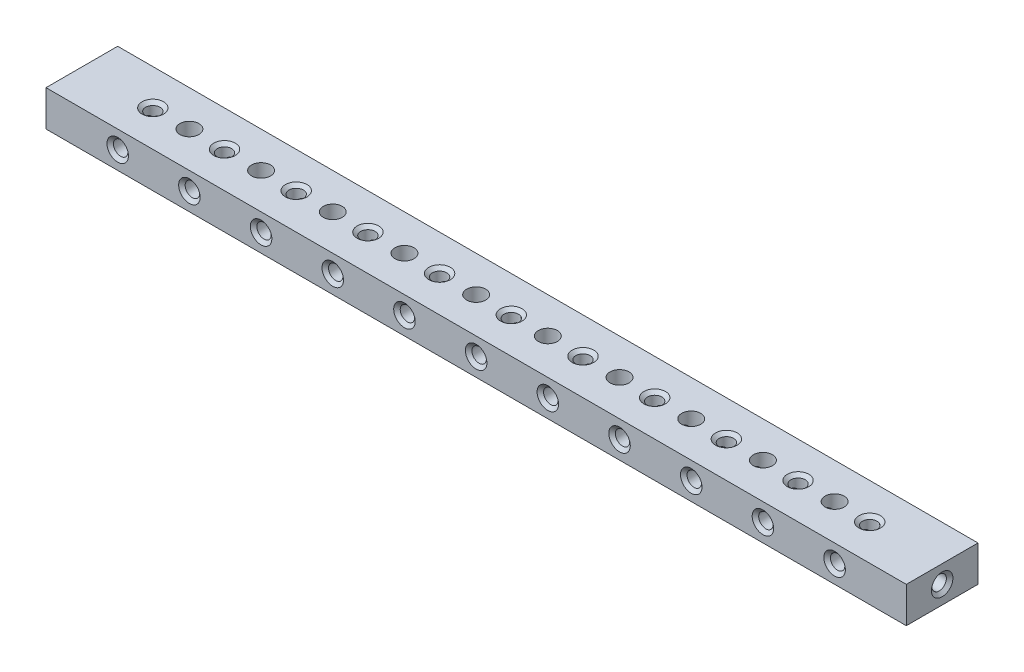
from build123d import *

# Parameters (mm, degrees)
SKETCH1_W                                            = 304.8
SKETCH1_H                                            = 25.4
BOSS_EXTRUDE1_DEPTH                                  = 12.7
F_1_4_20_TAPPED_HOLE1_D                              = 5.1054
F_1_4_20_TAPPED_HOLE1_CSINK_D                        = 7.62
F_1_4_20_TAPPED_HOLE1_CSINK_ANGLE                    = 100
LPATTERN1_COUNT                                      = 8
LPATTERN1_PITCH                                      = 25.4
F_1_4_20_TAPPED_HOLE2_D                              = 5.1054
F_1_4_20_TAPPED_HOLE2_CSINK_D                        = 7.62
F_1_4_20_TAPPED_HOLE2_CSINK_ANGLE                    = 100
LPATTERN2_COUNT                                      = 8
LPATTERN2_PITCH                                      = 25.4
CBORE_FOR_1_4_BINDING_HEAD_MACHINE_SCREW_D           = 6.7564
CBORE_FOR_1_4_BINDING_HEAD_MACHINE_SCREW_DEPTH       = 88.9
CBORE_FOR_1_4_BINDING_HEAD_MACHINE_SCREW_CBORE_D     = 14.2875
CBORE_FOR_1_4_BINDING_HEAD_MACHINE_SCREW_CBORE_DEPTH = 4.191
LPATTERN3_COUNT                                      = 7
LPATTERN3_PITCH                                      = 25.4
LPATTERN5_COUNT                                      = 4
LPATTERN5_PITCH                                      = 25.4
LPATTERN5_COUNT_DIR2                                 = 4
LPATTERN5_PITCH_DIR2                                 = 25.4
LPATTERN5_COPY_1_D                                   = 6.7564
LPATTERN5_COPY_1_DEPTH                               = 88.9
LPATTERN5_COPY_1_CBORE_D                             = 14.2875
LPATTERN5_COPY_1_CBORE_DEPTH                         = 4.191
LPATTERN5_COPY_2_D                                   = 6.7564
LPATTERN5_COPY_2_DEPTH                               = 88.9
LPATTERN5_COPY_2_CBORE_D                             = 14.2875
LPATTERN5_COPY_2_CBORE_DEPTH                         = 4.191
LPATTERN5_COPY_3_D                                   = 6.7564
LPATTERN5_COPY_3_DEPTH                               = 88.9
LPATTERN5_COPY_3_CBORE_D                             = 14.2875
LPATTERN5_COPY_3_CBORE_DEPTH                         = 4.191
LPATTERN5_COPY_4_D                                   = 6.7564
LPATTERN5_COPY_4_DEPTH                               = 88.9
LPATTERN5_COPY_4_CBORE_D                             = 14.2875
LPATTERN5_COPY_4_CBORE_DEPTH                         = 4.191
LPATTERN5_COPY_5_D                                   = 6.7564
LPATTERN5_COPY_5_DEPTH                               = 88.9
LPATTERN5_COPY_5_CBORE_D                             = 14.2875
LPATTERN5_COPY_5_CBORE_DEPTH                         = 4.191
LPATTERN5_COPY_6_D                                   = 6.7564
LPATTERN5_COPY_6_DEPTH                               = 88.9
LPATTERN5_COPY_6_CBORE_D                             = 14.2875
LPATTERN5_COPY_6_CBORE_DEPTH                         = 4.191
LPATTERN5_COPY_7_D                                   = 6.7564
LPATTERN5_COPY_7_DEPTH                               = 88.9
LPATTERN5_COPY_7_CBORE_D                             = 14.2875
LPATTERN5_COPY_7_CBORE_DEPTH                         = 4.191
LPATTERN5_COPY_8_D                                   = 6.7564
LPATTERN5_COPY_8_DEPTH                               = 88.9
LPATTERN5_COPY_8_CBORE_D                             = 14.2875
LPATTERN5_COPY_8_CBORE_DEPTH                         = 4.191
LPATTERN5_COPY_9_D                                   = 6.7564
LPATTERN5_COPY_9_DEPTH                               = 88.9
LPATTERN5_COPY_9_CBORE_D                             = 14.2875
LPATTERN5_COPY_9_CBORE_DEPTH                         = 4.191
LPATTERN5_COPY_10_D                                  = 6.7564
LPATTERN5_COPY_10_DEPTH                              = 88.9
LPATTERN5_COPY_10_CBORE_D                            = 14.2875
LPATTERN5_COPY_10_CBORE_DEPTH                        = 4.191
LPATTERN5_COPY_11_D                                  = 6.7564
LPATTERN5_COPY_11_DEPTH                              = 88.9
LPATTERN5_COPY_11_CBORE_D                            = 14.2875
LPATTERN5_COPY_11_CBORE_DEPTH                        = 4.191
LPATTERN5_COPY_12_D                                  = 6.7564
LPATTERN5_COPY_12_DEPTH                              = 88.9
LPATTERN5_COPY_12_CBORE_D                            = 14.2875
LPATTERN5_COPY_12_CBORE_DEPTH                        = 4.191
LPATTERN5_COPY_13_D                                  = 6.7564
LPATTERN5_COPY_13_DEPTH                              = 88.9
LPATTERN5_COPY_13_CBORE_D                            = 14.2875
LPATTERN5_COPY_13_CBORE_DEPTH                        = 4.191
LPATTERN5_COPY_14_D                                  = 6.7564
LPATTERN5_COPY_14_DEPTH                              = 88.9
LPATTERN5_COPY_14_CBORE_D                            = 14.2875
LPATTERN5_COPY_14_CBORE_DEPTH                        = 4.191
LPATTERN5_COPY_15_D                                  = 6.7564
LPATTERN5_COPY_15_DEPTH                              = 88.9
LPATTERN5_COPY_15_CBORE_D                            = 14.2875
LPATTERN5_COPY_15_CBORE_DEPTH                        = 4.191
LPATTERN5_COPY_16_D                                  = 6.7564
LPATTERN5_COPY_16_DEPTH                              = 88.9
LPATTERN5_COPY_16_CBORE_D                            = 14.2875
LPATTERN5_COPY_16_CBORE_DEPTH                        = 4.191
LPATTERN5_COPY_17_D                                  = 6.7564
LPATTERN5_COPY_17_DEPTH                              = 88.9
LPATTERN5_COPY_17_CBORE_D                            = 14.2875
LPATTERN5_COPY_17_CBORE_DEPTH                        = 4.191
LPATTERN5_COPY_18_D                                  = 6.7564
LPATTERN5_COPY_18_DEPTH                              = 88.9
LPATTERN5_COPY_18_CBORE_D                            = 14.2875
LPATTERN5_COPY_18_CBORE_DEPTH                        = 4.191
LPATTERN5_COPY_19_D                                  = 6.7564
LPATTERN5_COPY_19_DEPTH                              = 88.9
LPATTERN5_COPY_19_CBORE_D                            = 14.2875
LPATTERN5_COPY_19_CBORE_DEPTH                        = 4.191
LPATTERN5_COPY_20_D                                  = 6.7564
LPATTERN5_COPY_20_DEPTH                              = 88.9
LPATTERN5_COPY_20_CBORE_D                            = 14.2875
LPATTERN5_COPY_20_CBORE_DEPTH                        = 4.191
LPATTERN5_COPY_21_D                                  = 6.7564
LPATTERN5_COPY_21_DEPTH                              = 88.9
LPATTERN5_COPY_21_CBORE_D                            = 14.2875
LPATTERN5_COPY_21_CBORE_DEPTH                        = 4.191
LPATTERN5_COPY_22_D                                  = 6.7564
LPATTERN5_COPY_22_DEPTH                              = 88.9
LPATTERN5_COPY_22_CBORE_D                            = 14.2875
LPATTERN5_COPY_22_CBORE_DEPTH                        = 4.191
LPATTERN5_COPY_23_D                                  = 6.7564
LPATTERN5_COPY_23_DEPTH                              = 88.9
LPATTERN5_COPY_23_CBORE_D                            = 14.2875
LPATTERN5_COPY_23_CBORE_DEPTH                        = 4.191
LPATTERN5_COPY_24_D                                  = 6.7564
LPATTERN5_COPY_24_DEPTH                              = 88.9
LPATTERN5_COPY_24_CBORE_D                            = 14.2875
LPATTERN5_COPY_24_CBORE_DEPTH                        = 4.191
LPATTERN5_COPY_25_D                                  = 6.7564
LPATTERN5_COPY_25_DEPTH                              = 88.9
LPATTERN5_COPY_25_CBORE_D                            = 14.2875
LPATTERN5_COPY_25_CBORE_DEPTH                        = 4.191
LPATTERN5_COPY_26_D                                  = 6.7564
LPATTERN5_COPY_26_DEPTH                              = 88.9
LPATTERN5_COPY_26_CBORE_D                            = 14.2875
LPATTERN5_COPY_26_CBORE_DEPTH                        = 4.191
LPATTERN5_COPY_27_D                                  = 6.7564
LPATTERN5_COPY_27_DEPTH                              = 88.9
LPATTERN5_COPY_27_CBORE_D                            = 14.2875
LPATTERN5_COPY_27_CBORE_DEPTH                        = 4.191
LPATTERN5_COPY_28_D                                  = 6.7564
LPATTERN5_COPY_28_DEPTH                              = 88.9
LPATTERN5_COPY_28_CBORE_D                            = 14.2875
LPATTERN5_COPY_28_CBORE_DEPTH                        = 4.191
LPATTERN5_COPY_29_D                                  = 6.7564
LPATTERN5_COPY_29_DEPTH                              = 88.9
LPATTERN5_COPY_29_CBORE_D                            = 14.2875
LPATTERN5_COPY_29_CBORE_DEPTH                        = 4.191
LPATTERN5_COPY_30_D                                  = 6.7564
LPATTERN5_COPY_30_DEPTH                              = 88.9
LPATTERN5_COPY_30_CBORE_D                            = 14.2875
LPATTERN5_COPY_30_CBORE_DEPTH                        = 4.191
LPATTERN5_COPY_31_D                                  = 6.7564
LPATTERN5_COPY_31_DEPTH                              = 88.9
LPATTERN5_COPY_31_CBORE_D                            = 14.2875
LPATTERN5_COPY_31_CBORE_DEPTH                        = 4.191
LPATTERN5_COPY_32_D                                  = 6.7564
LPATTERN5_COPY_32_DEPTH                              = 88.9
LPATTERN5_COPY_32_CBORE_D                            = 14.2875
LPATTERN5_COPY_32_CBORE_DEPTH                        = 4.191
LPATTERN5_COPY_33_D                                  = 6.7564
LPATTERN5_COPY_33_DEPTH                              = 88.9
LPATTERN5_COPY_33_CBORE_D                            = 14.2875
LPATTERN5_COPY_33_CBORE_DEPTH                        = 4.191
LPATTERN5_COPY_34_D                                  = 6.7564
LPATTERN5_COPY_34_DEPTH                              = 88.9
LPATTERN5_COPY_34_CBORE_D                            = 14.2875
LPATTERN5_COPY_34_CBORE_DEPTH                        = 4.191
LPATTERN5_COPY_35_D                                  = 6.7564
LPATTERN5_COPY_35_DEPTH                              = 88.9
LPATTERN5_COPY_35_CBORE_D                            = 14.2875
LPATTERN5_COPY_35_CBORE_DEPTH                        = 4.191
LPATTERN5_COPY_36_D                                  = 6.7564
LPATTERN5_COPY_36_DEPTH                              = 88.9
LPATTERN5_COPY_36_CBORE_D                            = 14.2875
LPATTERN5_COPY_36_CBORE_DEPTH                        = 4.191
LPATTERN5_COPY_37_D                                  = 6.7564
LPATTERN5_COPY_37_DEPTH                              = 88.9
LPATTERN5_COPY_37_CBORE_D                            = 14.2875
LPATTERN5_COPY_37_CBORE_DEPTH                        = 4.191
LPATTERN5_COPY_38_D                                  = 6.7564
LPATTERN5_COPY_38_DEPTH                              = 88.9
LPATTERN5_COPY_38_CBORE_D                            = 14.2875
LPATTERN5_COPY_38_CBORE_DEPTH                        = 4.191
LPATTERN5_COPY_39_D                                  = 6.7564
LPATTERN5_COPY_39_DEPTH                              = 88.9
LPATTERN5_COPY_39_CBORE_D                            = 14.2875
LPATTERN5_COPY_39_CBORE_DEPTH                        = 4.191
LPATTERN5_COPY_40_D                                  = 6.7564
LPATTERN5_COPY_40_DEPTH                              = 88.9
LPATTERN5_COPY_40_CBORE_D                            = 14.2875
LPATTERN5_COPY_40_CBORE_DEPTH                        = 4.191
LPATTERN5_COPY_41_D                                  = 6.7564
LPATTERN5_COPY_41_DEPTH                              = 88.9
LPATTERN5_COPY_41_CBORE_D                            = 14.2875
LPATTERN5_COPY_41_CBORE_DEPTH                        = 4.191
LPATTERN5_COPY_42_D                                  = 6.7564
LPATTERN5_COPY_42_DEPTH                              = 88.9
LPATTERN5_COPY_42_CBORE_D                            = 14.2875
LPATTERN5_COPY_42_CBORE_DEPTH                        = 4.191
LPATTERN5_COPY_43_D                                  = 6.7564
LPATTERN5_COPY_43_DEPTH                              = 88.9
LPATTERN5_COPY_43_CBORE_D                            = 14.2875
LPATTERN5_COPY_43_CBORE_DEPTH                        = 4.191
LPATTERN5_COPY_44_D                                  = 6.7564
LPATTERN5_COPY_44_DEPTH                              = 88.9
LPATTERN5_COPY_44_CBORE_D                            = 14.2875
LPATTERN5_COPY_44_CBORE_DEPTH                        = 4.191
LPATTERN5_COPY_45_D                                  = 6.7564
LPATTERN5_COPY_45_DEPTH                              = 88.9
LPATTERN5_COPY_45_CBORE_D                            = 14.2875
LPATTERN5_COPY_45_CBORE_DEPTH                        = 4.191
LPATTERN5_COPY_46_D                                  = 6.7564
LPATTERN5_COPY_46_DEPTH                              = 88.9
LPATTERN5_COPY_46_CBORE_D                            = 14.2875
LPATTERN5_COPY_46_CBORE_DEPTH                        = 4.191
LPATTERN5_COPY_47_D                                  = 6.7564
LPATTERN5_COPY_47_DEPTH                              = 88.9
LPATTERN5_COPY_47_CBORE_D                            = 14.2875
LPATTERN5_COPY_47_CBORE_DEPTH                        = 4.191
LPATTERN5_COPY_48_D                                  = 6.7564
LPATTERN5_COPY_48_DEPTH                              = 88.9
LPATTERN5_COPY_48_CBORE_D                            = 14.2875
LPATTERN5_COPY_48_CBORE_DEPTH                        = 4.191
LPATTERN5_COPY_49_D                                  = 6.7564
LPATTERN5_COPY_49_DEPTH                              = 88.9
LPATTERN5_COPY_49_CBORE_D                            = 14.2875
LPATTERN5_COPY_49_CBORE_DEPTH                        = 4.191
LPATTERN5_COPY_50_D                                  = 6.7564
LPATTERN5_COPY_50_DEPTH                              = 88.9
LPATTERN5_COPY_50_CBORE_D                            = 14.2875
LPATTERN5_COPY_50_CBORE_DEPTH                        = 4.191
LPATTERN5_COPY_51_D                                  = 6.7564
LPATTERN5_COPY_51_DEPTH                              = 88.9
LPATTERN5_COPY_51_CBORE_D                            = 14.2875
LPATTERN5_COPY_51_CBORE_DEPTH                        = 4.191
LPATTERN5_COPY_52_D                                  = 6.7564
LPATTERN5_COPY_52_DEPTH                              = 88.9
LPATTERN5_COPY_52_CBORE_D                            = 14.2875
LPATTERN5_COPY_52_CBORE_DEPTH                        = 4.191
LPATTERN5_COPY_53_D                                  = 6.7564
LPATTERN5_COPY_53_DEPTH                              = 88.9
LPATTERN5_COPY_53_CBORE_D                            = 14.2875
LPATTERN5_COPY_53_CBORE_DEPTH                        = 4.191
LPATTERN5_COPY_54_D                                  = 6.7564
LPATTERN5_COPY_54_DEPTH                              = 88.9
LPATTERN5_COPY_54_CBORE_D                            = 14.2875
LPATTERN5_COPY_54_CBORE_DEPTH                        = 4.191
LPATTERN5_COPY_55_D                                  = 6.7564
LPATTERN5_COPY_55_DEPTH                              = 88.9
LPATTERN5_COPY_55_CBORE_D                            = 14.2875
LPATTERN5_COPY_55_CBORE_DEPTH                        = 4.191
LPATTERN5_COPY_56_D                                  = 6.7564
LPATTERN5_COPY_56_DEPTH                              = 88.9
LPATTERN5_COPY_56_CBORE_D                            = 14.2875
LPATTERN5_COPY_56_CBORE_DEPTH                        = 4.191
LPATTERN5_COPY_57_D                                  = 6.7564
LPATTERN5_COPY_57_DEPTH                              = 88.9
LPATTERN5_COPY_57_CBORE_D                            = 14.2875
LPATTERN5_COPY_57_CBORE_DEPTH                        = 4.191
LPATTERN5_COPY_58_D                                  = 6.7564
LPATTERN5_COPY_58_DEPTH                              = 88.9
LPATTERN5_COPY_58_CBORE_D                            = 14.2875
LPATTERN5_COPY_58_CBORE_DEPTH                        = 4.191
LPATTERN5_COPY_59_D                                  = 6.7564
LPATTERN5_COPY_59_DEPTH                              = 88.9
LPATTERN5_COPY_59_CBORE_D                            = 14.2875
LPATTERN5_COPY_59_CBORE_DEPTH                        = 4.191
LPATTERN5_COPY_60_D                                  = 6.7564
LPATTERN5_COPY_60_DEPTH                              = 88.9
LPATTERN5_COPY_60_CBORE_D                            = 14.2875
LPATTERN5_COPY_60_CBORE_DEPTH                        = 4.191
LPATTERN5_COPY_61_D                                  = 6.7564
LPATTERN5_COPY_61_DEPTH                              = 88.9
LPATTERN5_COPY_61_CBORE_D                            = 14.2875
LPATTERN5_COPY_61_CBORE_DEPTH                        = 4.191
LPATTERN5_COPY_62_D                                  = 6.7564
LPATTERN5_COPY_62_DEPTH                              = 88.9
LPATTERN5_COPY_62_CBORE_D                            = 14.2875
LPATTERN5_COPY_62_CBORE_DEPTH                        = 4.191
LPATTERN5_COPY_63_D                                  = 6.7564
LPATTERN5_COPY_63_DEPTH                              = 88.9
LPATTERN5_COPY_63_CBORE_D                            = 14.2875
LPATTERN5_COPY_63_CBORE_DEPTH                        = 4.191
LPATTERN5_COPY_64_D                                  = 6.7564
LPATTERN5_COPY_64_DEPTH                              = 88.9
LPATTERN5_COPY_64_CBORE_D                            = 14.2875
LPATTERN5_COPY_64_CBORE_DEPTH                        = 4.191
LPATTERN5_COPY_65_D                                  = 6.7564
LPATTERN5_COPY_65_DEPTH                              = 88.9
LPATTERN5_COPY_65_CBORE_D                            = 14.2875
LPATTERN5_COPY_65_CBORE_DEPTH                        = 4.191
LPATTERN5_COPY_66_D                                  = 6.7564
LPATTERN5_COPY_66_DEPTH                              = 88.9
LPATTERN5_COPY_66_CBORE_D                            = 14.2875
LPATTERN5_COPY_66_CBORE_DEPTH                        = 4.191
LPATTERN5_COPY_67_D                                  = 6.7564
LPATTERN5_COPY_67_DEPTH                              = 88.9
LPATTERN5_COPY_67_CBORE_D                            = 14.2875
LPATTERN5_COPY_67_CBORE_DEPTH                        = 4.191
LPATTERN5_COPY_68_D                                  = 6.7564
LPATTERN5_COPY_68_DEPTH                              = 88.9
LPATTERN5_COPY_68_CBORE_D                            = 14.2875
LPATTERN5_COPY_68_CBORE_DEPTH                        = 4.191
LPATTERN5_COPY_69_D                                  = 6.7564
LPATTERN5_COPY_69_DEPTH                              = 88.9
LPATTERN5_COPY_69_CBORE_D                            = 14.2875
LPATTERN5_COPY_69_CBORE_DEPTH                        = 4.191
LPATTERN5_COPY_70_D                                  = 6.7564
LPATTERN5_COPY_70_DEPTH                              = 88.9
LPATTERN5_COPY_70_CBORE_D                            = 14.2875
LPATTERN5_COPY_70_CBORE_DEPTH                        = 4.191
LPATTERN5_COPY_71_D                                  = 6.7564
LPATTERN5_COPY_71_DEPTH                              = 88.9
LPATTERN5_COPY_71_CBORE_D                            = 14.2875
LPATTERN5_COPY_71_CBORE_DEPTH                        = 4.191
LPATTERN5_COPY_72_D                                  = 6.7564
LPATTERN5_COPY_72_DEPTH                              = 88.9
LPATTERN5_COPY_72_CBORE_D                            = 14.2875
LPATTERN5_COPY_72_CBORE_DEPTH                        = 4.191
LPATTERN5_COPY_73_D                                  = 6.7564
LPATTERN5_COPY_73_DEPTH                              = 88.9
LPATTERN5_COPY_73_CBORE_D                            = 14.2875
LPATTERN5_COPY_73_CBORE_DEPTH                        = 4.191
LPATTERN5_COPY_74_D                                  = 6.7564
LPATTERN5_COPY_74_DEPTH                              = 88.9
LPATTERN5_COPY_74_CBORE_D                            = 14.2875
LPATTERN5_COPY_74_CBORE_DEPTH                        = 4.191
LPATTERN5_COPY_75_D                                  = 6.7564
LPATTERN5_COPY_75_DEPTH                              = 88.9
LPATTERN5_COPY_75_CBORE_D                            = 14.2875
LPATTERN5_COPY_75_CBORE_DEPTH                        = 4.191
LPATTERN5_COPY_76_D                                  = 6.7564
LPATTERN5_COPY_76_DEPTH                              = 88.9
LPATTERN5_COPY_76_CBORE_D                            = 14.2875
LPATTERN5_COPY_76_CBORE_DEPTH                        = 4.191
LPATTERN5_COPY_77_D                                  = 6.7564
LPATTERN5_COPY_77_DEPTH                              = 88.9
LPATTERN5_COPY_77_CBORE_D                            = 14.2875
LPATTERN5_COPY_77_CBORE_DEPTH                        = 4.191
LPATTERN5_COPY_78_D                                  = 6.7564
LPATTERN5_COPY_78_DEPTH                              = 88.9
LPATTERN5_COPY_78_CBORE_D                            = 14.2875
LPATTERN5_COPY_78_CBORE_DEPTH                        = 4.191
LPATTERN5_COPY_79_D                                  = 6.7564
LPATTERN5_COPY_79_DEPTH                              = 88.9
LPATTERN5_COPY_79_CBORE_D                            = 14.2875
LPATTERN5_COPY_79_CBORE_DEPTH                        = 4.191
LPATTERN5_COPY_80_D                                  = 6.7564
LPATTERN5_COPY_80_DEPTH                              = 88.9
LPATTERN5_COPY_80_CBORE_D                            = 14.2875
LPATTERN5_COPY_80_CBORE_DEPTH                        = 4.191
LPATTERN5_COPY_81_D                                  = 6.7564
LPATTERN5_COPY_81_DEPTH                              = 88.9
LPATTERN5_COPY_81_CBORE_D                            = 14.2875
LPATTERN5_COPY_81_CBORE_DEPTH                        = 4.191
LPATTERN5_COPY_82_D                                  = 6.7564
LPATTERN5_COPY_82_DEPTH                              = 88.9
LPATTERN5_COPY_82_CBORE_D                            = 14.2875
LPATTERN5_COPY_82_CBORE_DEPTH                        = 4.191
LPATTERN5_COPY_83_D                                  = 6.7564
LPATTERN5_COPY_83_DEPTH                              = 88.9
LPATTERN5_COPY_83_CBORE_D                            = 14.2875
LPATTERN5_COPY_83_CBORE_DEPTH                        = 4.191
LPATTERN5_COPY_84_D                                  = 6.7564
LPATTERN5_COPY_84_DEPTH                              = 88.9
LPATTERN5_COPY_84_CBORE_D                            = 14.2875
LPATTERN5_COPY_84_CBORE_DEPTH                        = 4.191
LPATTERN5_COPY_85_D                                  = 6.7564
LPATTERN5_COPY_85_DEPTH                              = 88.9
LPATTERN5_COPY_85_CBORE_D                            = 14.2875
LPATTERN5_COPY_85_CBORE_DEPTH                        = 4.191
LPATTERN5_COPY_86_D                                  = 6.7564
LPATTERN5_COPY_86_DEPTH                              = 88.9
LPATTERN5_COPY_86_CBORE_D                            = 14.2875
LPATTERN5_COPY_86_CBORE_DEPTH                        = 4.191
LPATTERN5_COPY_87_D                                  = 6.7564
LPATTERN5_COPY_87_DEPTH                              = 88.9
LPATTERN5_COPY_87_CBORE_D                            = 14.2875
LPATTERN5_COPY_87_CBORE_DEPTH                        = 4.191
LPATTERN5_COPY_88_D                                  = 6.7564
LPATTERN5_COPY_88_DEPTH                              = 88.9
LPATTERN5_COPY_88_CBORE_D                            = 14.2875
LPATTERN5_COPY_88_CBORE_DEPTH                        = 4.191
LPATTERN5_COPY_89_D                                  = 6.7564
LPATTERN5_COPY_89_DEPTH                              = 88.9
LPATTERN5_COPY_89_CBORE_D                            = 14.2875
LPATTERN5_COPY_89_CBORE_DEPTH                        = 4.191
LPATTERN5_COPY_90_D                                  = 6.7564
LPATTERN5_COPY_90_DEPTH                              = 88.9
LPATTERN5_COPY_90_CBORE_D                            = 14.2875
LPATTERN5_COPY_90_CBORE_DEPTH                        = 4.191
LPATTERN6_COUNT                                      = 4
LPATTERN6_PITCH                                      = 25.4


# Read off the part's stored shape, not the designer's step: 1/4-20 Tapped Hole3, 1/4-20 Tapped Hole4, LPattern4
with BuildPart() as part:
    # Sketch1 → Boss-Extrude1 (new body)
    with BuildSketch(Plane(origin=(0, 0, 0), x_dir=(1, 0, 0), z_dir=(0, 1, 0))):
        Rectangle(SKETCH1_W, SKETCH1_H)
    extrude(amount=BOSS_EXTRUDE1_DEPTH)

    # 1/4-20 Tapped Hole1 (through all)
    with Locations(Plane.XY.offset(12.7)):
        with Locations((50.8, 6.35)):
            f_1_4_20_tapped_hole1 = CounterSinkHole(F_1_4_20_TAPPED_HOLE1_D / 2, F_1_4_20_TAPPED_HOLE1_CSINK_D / 2, counter_sink_angle=F_1_4_20_TAPPED_HOLE1_CSINK_ANGLE)

    # LPattern1: 1/4-20 Tapped Hole1 ×8
    with Locations(*[(-i * LPATTERN1_PITCH, 0, 0) for i in range(1, LPATTERN1_COUNT)]):
        add(f_1_4_20_tapped_hole1, mode=Mode.SUBTRACT)

    # 1/4-20 Tapped Hole2 (through all)
    with Locations(Plane(origin=(0, 12.7, 0), x_dir=(1, 0, 0), z_dir=(0, 1, 0))):
        with Locations((50.549669318, 0)):
            f_1_4_20_tapped_hole2 = CounterSinkHole(F_1_4_20_TAPPED_HOLE2_D / 2, F_1_4_20_TAPPED_HOLE2_CSINK_D / 2, counter_sink_angle=F_1_4_20_TAPPED_HOLE2_CSINK_ANGLE)

    # LPattern2: 1/4-20 Tapped Hole2 ×8
    with Locations(*[(-i * LPATTERN2_PITCH, 0, 0) for i in range(1, LPATTERN2_COUNT)]):
        add(f_1_4_20_tapped_hole2, mode=Mode.SUBTRACT)

    # 1/4-20 Tapped Hole3 outline → 1/4-20 Tapped Hole3 (revolve, cut)
    with BuildSketch(Plane(origin=(0, 6.35, 0), x_dir=(0, 1, 0), z_dir=(0, 0, -1))):
        Polygon((0, 52.475521273), (2.5527, 52.475521273), (2.5527, 151.345000034), (3.81, 152.4), (0, 152.4), align=None)
    revolve(axis=Axis((0, 6.35, 0), (1, 0, 0)), mode=Mode.SUBTRACT)

    # 1/4-20 Tapped Hole4 outline → 1/4-20 Tapped Hole4 (revolve, cut)
    with BuildSketch(Plane(origin=(0, 6.358627193, 0), x_dir=(0, 1, 0), z_dir=(0, 0, -1))):
        Polygon((2.5527, -151.345000034), (2.5527, -128.921833005), (0, -128.921833005), (0, -152.4), (3.81, -152.4), align=None)
    revolve(axis=Axis((0, 6.358627193, 0), (1, 0, 0)), mode=Mode.SUBTRACT)

    # CBORE for 1/4 Binding Head Machine Screw1
    with Locations(Plane(origin=(0, 0, 0), x_dir=(-1, 0, 0), z_dir=(0, -1, 0))):
        with Locations((-38.1, 0)):
            cbore_for_1_4_binding_head_machine_screw = CounterBoreHole(CBORE_FOR_1_4_BINDING_HEAD_MACHINE_SCREW_D / 2, CBORE_FOR_1_4_BINDING_HEAD_MACHINE_SCREW_CBORE_D / 2, CBORE_FOR_1_4_BINDING_HEAD_MACHINE_SCREW_CBORE_DEPTH, depth=CBORE_FOR_1_4_BINDING_HEAD_MACHINE_SCREW_DEPTH)

    # LPattern3: CBORE for 1/4 Binding Head Machine Screw1 ×7
    with Locations(*[(-i * LPATTERN3_PITCH, 0, 0) for i in range(1, LPATTERN3_COUNT)]):
        add(cbore_for_1_4_binding_head_machine_screw, mode=Mode.SUBTRACT)

    # LPattern4 outline → LPattern4 (revolve, cut)
    with BuildSketch(Plane(origin=(76.2, 6.35, 0), x_dir=(1, 0, 0), z_dir=(0, -1, 0))):
        Polygon((0, 0), (2.5527, 0), (2.5527, 11.645000034), (3.81, 12.7), (0, 12.7), align=None)
    revolve(axis=Axis((76.2, 6.35, 0), (0, 0, 1)), mode=Mode.SUBTRACT)

    # LPattern4 2 outline → LPattern4 2 (revolve, cut)
    with BuildSketch(Plane(origin=(101.6, 6.35, 0), x_dir=(1, 0, 0), z_dir=(0, -1, 0))):
        Polygon((0, 0), (2.5527, 0), (2.5527, 11.645000034), (3.81, 12.7), (0, 12.7), align=None)
    revolve(axis=Axis((101.6, 6.35, 0), (0, 0, 1)), mode=Mode.SUBTRACT)

    # LPattern4 3 outline → LPattern4 3 (revolve, cut)
    with BuildSketch(Plane(origin=(127, 6.35, 0), x_dir=(1, 0, 0), z_dir=(0, -1, 0))):
        Polygon((0, 0), (2.5527, 0), (2.5527, 11.645000034), (3.81, 12.7), (0, 12.7), align=None)
    revolve(axis=Axis((127, 6.35, 0), (0, 0, 1)), mode=Mode.SUBTRACT)

    # LPattern5: CBORE for 1_4 Binding Head Machine Screw 4 × 4
    with Locations(*[(j * LPATTERN5_PITCH_DIR2, -i * LPATTERN5_PITCH, 0) for i in range(LPATTERN5_COUNT) for j in range(LPATTERN5_COUNT_DIR2) if (i, j) != (0, 0)]):
        add(cbore_for_1_4_binding_head_machine_screw, mode=Mode.SUBTRACT)

    # LPattern5 copy 1
    with Locations(Plane(origin=(0, 0, 0), x_dir=(-1, 0, 0), z_dir=(0, -1, 0))):
        with Locations((-38.1, 0)):
            CounterBoreHole(LPATTERN5_COPY_1_D / 2, LPATTERN5_COPY_1_CBORE_D / 2, LPATTERN5_COPY_1_CBORE_DEPTH, depth=LPATTERN5_COPY_1_DEPTH)

    # LPattern5 copy 2
    with Locations(Plane(origin=(25.4, 0, 0), x_dir=(-1, 0, 0), z_dir=(0, -1, 0))):
        with Locations((-38.1, 0)):
            CounterBoreHole(LPATTERN5_COPY_2_D / 2, LPATTERN5_COPY_2_CBORE_D / 2, LPATTERN5_COPY_2_CBORE_DEPTH, depth=LPATTERN5_COPY_2_DEPTH)

    # LPattern5 copy 3
    with Locations(Plane(origin=(50.8, 0, 0), x_dir=(-1, 0, 0), z_dir=(0, -1, 0))):
        with Locations((-38.1, 0)):
            CounterBoreHole(LPATTERN5_COPY_3_D / 2, LPATTERN5_COPY_3_CBORE_D / 2, LPATTERN5_COPY_3_CBORE_DEPTH, depth=LPATTERN5_COPY_3_DEPTH)

    # LPattern5 copy 4
    with Locations(Plane(origin=(-25.4, -25.4, 0), x_dir=(-1, 0, 0), z_dir=(0, -1, 0))):
        with Locations((-38.1, 0)):
            CounterBoreHole(LPATTERN5_COPY_4_D / 2, LPATTERN5_COPY_4_CBORE_D / 2, LPATTERN5_COPY_4_CBORE_DEPTH, depth=LPATTERN5_COPY_4_DEPTH)

    # LPattern5 copy 5
    with Locations(Plane(origin=(0, -25.4, 0), x_dir=(-1, 0, 0), z_dir=(0, -1, 0))):
        with Locations((-38.1, 0)):
            CounterBoreHole(LPATTERN5_COPY_5_D / 2, LPATTERN5_COPY_5_CBORE_D / 2, LPATTERN5_COPY_5_CBORE_DEPTH, depth=LPATTERN5_COPY_5_DEPTH)

    # LPattern5 copy 6
    with Locations(Plane(origin=(25.4, -25.4, 0), x_dir=(-1, 0, 0), z_dir=(0, -1, 0))):
        with Locations((-38.1, 0)):
            CounterBoreHole(LPATTERN5_COPY_6_D / 2, LPATTERN5_COPY_6_CBORE_D / 2, LPATTERN5_COPY_6_CBORE_DEPTH, depth=LPATTERN5_COPY_6_DEPTH)

    # LPattern5 copy 7
    with Locations(Plane(origin=(50.8, -25.4, 0), x_dir=(-1, 0, 0), z_dir=(0, -1, 0))):
        with Locations((-38.1, 0)):
            CounterBoreHole(LPATTERN5_COPY_7_D / 2, LPATTERN5_COPY_7_CBORE_D / 2, LPATTERN5_COPY_7_CBORE_DEPTH, depth=LPATTERN5_COPY_7_DEPTH)

    # LPattern5 copy 8
    with Locations(Plane(origin=(-25.4, -50.8, 0), x_dir=(-1, 0, 0), z_dir=(0, -1, 0))):
        with Locations((-38.1, 0)):
            CounterBoreHole(LPATTERN5_COPY_8_D / 2, LPATTERN5_COPY_8_CBORE_D / 2, LPATTERN5_COPY_8_CBORE_DEPTH, depth=LPATTERN5_COPY_8_DEPTH)

    # LPattern5 copy 9
    with Locations(Plane(origin=(0, -50.8, 0), x_dir=(-1, 0, 0), z_dir=(0, -1, 0))):
        with Locations((-38.1, 0)):
            CounterBoreHole(LPATTERN5_COPY_9_D / 2, LPATTERN5_COPY_9_CBORE_D / 2, LPATTERN5_COPY_9_CBORE_DEPTH, depth=LPATTERN5_COPY_9_DEPTH)

    # LPattern5 copy 10
    with Locations(Plane(origin=(25.4, -50.8, 0), x_dir=(-1, 0, 0), z_dir=(0, -1, 0))):
        with Locations((-38.1, 0)):
            CounterBoreHole(LPATTERN5_COPY_10_D / 2, LPATTERN5_COPY_10_CBORE_D / 2, LPATTERN5_COPY_10_CBORE_DEPTH, depth=LPATTERN5_COPY_10_DEPTH)

    # LPattern5 copy 11
    with Locations(Plane(origin=(50.8, -50.8, 0), x_dir=(-1, 0, 0), z_dir=(0, -1, 0))):
        with Locations((-38.1, 0)):
            CounterBoreHole(LPATTERN5_COPY_11_D / 2, LPATTERN5_COPY_11_CBORE_D / 2, LPATTERN5_COPY_11_CBORE_DEPTH, depth=LPATTERN5_COPY_11_DEPTH)

    # LPattern5 copy 12
    with Locations(Plane(origin=(-25.4, -76.2, 0), x_dir=(-1, 0, 0), z_dir=(0, -1, 0))):
        with Locations((-38.1, 0)):
            CounterBoreHole(LPATTERN5_COPY_12_D / 2, LPATTERN5_COPY_12_CBORE_D / 2, LPATTERN5_COPY_12_CBORE_DEPTH, depth=LPATTERN5_COPY_12_DEPTH)

    # LPattern5 copy 13
    with Locations(Plane(origin=(0, -76.2, 0), x_dir=(-1, 0, 0), z_dir=(0, -1, 0))):
        with Locations((-38.1, 0)):
            CounterBoreHole(LPATTERN5_COPY_13_D / 2, LPATTERN5_COPY_13_CBORE_D / 2, LPATTERN5_COPY_13_CBORE_DEPTH, depth=LPATTERN5_COPY_13_DEPTH)

    # LPattern5 copy 14
    with Locations(Plane(origin=(25.4, -76.2, 0), x_dir=(-1, 0, 0), z_dir=(0, -1, 0))):
        with Locations((-38.1, 0)):
            CounterBoreHole(LPATTERN5_COPY_14_D / 2, LPATTERN5_COPY_14_CBORE_D / 2, LPATTERN5_COPY_14_CBORE_DEPTH, depth=LPATTERN5_COPY_14_DEPTH)

    # LPattern5 copy 15
    with Locations(Plane(origin=(50.8, -76.2, 0), x_dir=(-1, 0, 0), z_dir=(0, -1, 0))):
        with Locations((-38.1, 0)):
            CounterBoreHole(LPATTERN5_COPY_15_D / 2, LPATTERN5_COPY_15_CBORE_D / 2, LPATTERN5_COPY_15_CBORE_DEPTH, depth=LPATTERN5_COPY_15_DEPTH)

    # LPattern5 copy 16
    with Locations(Plane(origin=(-25.4, 0, 0), x_dir=(-1, 0, 0), z_dir=(0, -1, 0))):
        with Locations((-38.1, 0)):
            CounterBoreHole(LPATTERN5_COPY_16_D / 2, LPATTERN5_COPY_16_CBORE_D / 2, LPATTERN5_COPY_16_CBORE_DEPTH, depth=LPATTERN5_COPY_16_DEPTH)

    # LPattern5 copy 17
    with Locations(Plane(origin=(0, 0, 0), x_dir=(-1, 0, 0), z_dir=(0, -1, 0))):
        with Locations((-38.1, 0)):
            CounterBoreHole(LPATTERN5_COPY_17_D / 2, LPATTERN5_COPY_17_CBORE_D / 2, LPATTERN5_COPY_17_CBORE_DEPTH, depth=LPATTERN5_COPY_17_DEPTH)

    # LPattern5 copy 18
    with Locations(Plane(origin=(25.4, 0, 0), x_dir=(-1, 0, 0), z_dir=(0, -1, 0))):
        with Locations((-38.1, 0)):
            CounterBoreHole(LPATTERN5_COPY_18_D / 2, LPATTERN5_COPY_18_CBORE_D / 2, LPATTERN5_COPY_18_CBORE_DEPTH, depth=LPATTERN5_COPY_18_DEPTH)

    # LPattern5 copy 19
    with Locations(Plane(origin=(-50.8, -25.4, 0), x_dir=(-1, 0, 0), z_dir=(0, -1, 0))):
        with Locations((-38.1, 0)):
            CounterBoreHole(LPATTERN5_COPY_19_D / 2, LPATTERN5_COPY_19_CBORE_D / 2, LPATTERN5_COPY_19_CBORE_DEPTH, depth=LPATTERN5_COPY_19_DEPTH)

    # LPattern5 copy 20
    with Locations(Plane(origin=(-25.4, -25.4, 0), x_dir=(-1, 0, 0), z_dir=(0, -1, 0))):
        with Locations((-38.1, 0)):
            CounterBoreHole(LPATTERN5_COPY_20_D / 2, LPATTERN5_COPY_20_CBORE_D / 2, LPATTERN5_COPY_20_CBORE_DEPTH, depth=LPATTERN5_COPY_20_DEPTH)

    # LPattern5 copy 21
    with Locations(Plane(origin=(0, -25.4, 0), x_dir=(-1, 0, 0), z_dir=(0, -1, 0))):
        with Locations((-38.1, 0)):
            CounterBoreHole(LPATTERN5_COPY_21_D / 2, LPATTERN5_COPY_21_CBORE_D / 2, LPATTERN5_COPY_21_CBORE_DEPTH, depth=LPATTERN5_COPY_21_DEPTH)

    # LPattern5 copy 22
    with Locations(Plane(origin=(25.4, -25.4, 0), x_dir=(-1, 0, 0), z_dir=(0, -1, 0))):
        with Locations((-38.1, 0)):
            CounterBoreHole(LPATTERN5_COPY_22_D / 2, LPATTERN5_COPY_22_CBORE_D / 2, LPATTERN5_COPY_22_CBORE_DEPTH, depth=LPATTERN5_COPY_22_DEPTH)

    # LPattern5 copy 23
    with Locations(Plane(origin=(-50.8, -50.8, 0), x_dir=(-1, 0, 0), z_dir=(0, -1, 0))):
        with Locations((-38.1, 0)):
            CounterBoreHole(LPATTERN5_COPY_23_D / 2, LPATTERN5_COPY_23_CBORE_D / 2, LPATTERN5_COPY_23_CBORE_DEPTH, depth=LPATTERN5_COPY_23_DEPTH)

    # LPattern5 copy 24
    with Locations(Plane(origin=(-25.4, -50.8, 0), x_dir=(-1, 0, 0), z_dir=(0, -1, 0))):
        with Locations((-38.1, 0)):
            CounterBoreHole(LPATTERN5_COPY_24_D / 2, LPATTERN5_COPY_24_CBORE_D / 2, LPATTERN5_COPY_24_CBORE_DEPTH, depth=LPATTERN5_COPY_24_DEPTH)

    # LPattern5 copy 25
    with Locations(Plane(origin=(0, -50.8, 0), x_dir=(-1, 0, 0), z_dir=(0, -1, 0))):
        with Locations((-38.1, 0)):
            CounterBoreHole(LPATTERN5_COPY_25_D / 2, LPATTERN5_COPY_25_CBORE_D / 2, LPATTERN5_COPY_25_CBORE_DEPTH, depth=LPATTERN5_COPY_25_DEPTH)

    # LPattern5 copy 26
    with Locations(Plane(origin=(25.4, -50.8, 0), x_dir=(-1, 0, 0), z_dir=(0, -1, 0))):
        with Locations((-38.1, 0)):
            CounterBoreHole(LPATTERN5_COPY_26_D / 2, LPATTERN5_COPY_26_CBORE_D / 2, LPATTERN5_COPY_26_CBORE_DEPTH, depth=LPATTERN5_COPY_26_DEPTH)

    # LPattern5 copy 27
    with Locations(Plane(origin=(-50.8, -76.2, 0), x_dir=(-1, 0, 0), z_dir=(0, -1, 0))):
        with Locations((-38.1, 0)):
            CounterBoreHole(LPATTERN5_COPY_27_D / 2, LPATTERN5_COPY_27_CBORE_D / 2, LPATTERN5_COPY_27_CBORE_DEPTH, depth=LPATTERN5_COPY_27_DEPTH)

    # LPattern5 copy 28
    with Locations(Plane(origin=(-25.4, -76.2, 0), x_dir=(-1, 0, 0), z_dir=(0, -1, 0))):
        with Locations((-38.1, 0)):
            CounterBoreHole(LPATTERN5_COPY_28_D / 2, LPATTERN5_COPY_28_CBORE_D / 2, LPATTERN5_COPY_28_CBORE_DEPTH, depth=LPATTERN5_COPY_28_DEPTH)

    # LPattern5 copy 29
    with Locations(Plane(origin=(0, -76.2, 0), x_dir=(-1, 0, 0), z_dir=(0, -1, 0))):
        with Locations((-38.1, 0)):
            CounterBoreHole(LPATTERN5_COPY_29_D / 2, LPATTERN5_COPY_29_CBORE_D / 2, LPATTERN5_COPY_29_CBORE_DEPTH, depth=LPATTERN5_COPY_29_DEPTH)

    # LPattern5 copy 30
    with Locations(Plane(origin=(25.4, -76.2, 0), x_dir=(-1, 0, 0), z_dir=(0, -1, 0))):
        with Locations((-38.1, 0)):
            CounterBoreHole(LPATTERN5_COPY_30_D / 2, LPATTERN5_COPY_30_CBORE_D / 2, LPATTERN5_COPY_30_CBORE_DEPTH, depth=LPATTERN5_COPY_30_DEPTH)

    # LPattern5 copy 31
    with Locations(Plane(origin=(-50.8, 0, 0), x_dir=(-1, 0, 0), z_dir=(0, -1, 0))):
        with Locations((-38.1, 0)):
            CounterBoreHole(LPATTERN5_COPY_31_D / 2, LPATTERN5_COPY_31_CBORE_D / 2, LPATTERN5_COPY_31_CBORE_DEPTH, depth=LPATTERN5_COPY_31_DEPTH)

    # LPattern5 copy 32
    with Locations(Plane(origin=(-25.4, 0, 0), x_dir=(-1, 0, 0), z_dir=(0, -1, 0))):
        with Locations((-38.1, 0)):
            CounterBoreHole(LPATTERN5_COPY_32_D / 2, LPATTERN5_COPY_32_CBORE_D / 2, LPATTERN5_COPY_32_CBORE_DEPTH, depth=LPATTERN5_COPY_32_DEPTH)

    # LPattern5 copy 33
    with Locations(Plane(origin=(0, 0, 0), x_dir=(-1, 0, 0), z_dir=(0, -1, 0))):
        with Locations((-38.1, 0)):
            CounterBoreHole(LPATTERN5_COPY_33_D / 2, LPATTERN5_COPY_33_CBORE_D / 2, LPATTERN5_COPY_33_CBORE_DEPTH, depth=LPATTERN5_COPY_33_DEPTH)

    # LPattern5 copy 34
    with Locations(Plane(origin=(-76.2, -25.4, 0), x_dir=(-1, 0, 0), z_dir=(0, -1, 0))):
        with Locations((-38.1, 0)):
            CounterBoreHole(LPATTERN5_COPY_34_D / 2, LPATTERN5_COPY_34_CBORE_D / 2, LPATTERN5_COPY_34_CBORE_DEPTH, depth=LPATTERN5_COPY_34_DEPTH)

    # LPattern5 copy 35
    with Locations(Plane(origin=(-50.8, -25.4, 0), x_dir=(-1, 0, 0), z_dir=(0, -1, 0))):
        with Locations((-38.1, 0)):
            CounterBoreHole(LPATTERN5_COPY_35_D / 2, LPATTERN5_COPY_35_CBORE_D / 2, LPATTERN5_COPY_35_CBORE_DEPTH, depth=LPATTERN5_COPY_35_DEPTH)

    # LPattern5 copy 36
    with Locations(Plane(origin=(-25.4, -25.4, 0), x_dir=(-1, 0, 0), z_dir=(0, -1, 0))):
        with Locations((-38.1, 0)):
            CounterBoreHole(LPATTERN5_COPY_36_D / 2, LPATTERN5_COPY_36_CBORE_D / 2, LPATTERN5_COPY_36_CBORE_DEPTH, depth=LPATTERN5_COPY_36_DEPTH)

    # LPattern5 copy 37
    with Locations(Plane(origin=(0, -25.4, 0), x_dir=(-1, 0, 0), z_dir=(0, -1, 0))):
        with Locations((-38.1, 0)):
            CounterBoreHole(LPATTERN5_COPY_37_D / 2, LPATTERN5_COPY_37_CBORE_D / 2, LPATTERN5_COPY_37_CBORE_DEPTH, depth=LPATTERN5_COPY_37_DEPTH)

    # LPattern5 copy 38
    with Locations(Plane(origin=(-76.2, -50.8, 0), x_dir=(-1, 0, 0), z_dir=(0, -1, 0))):
        with Locations((-38.1, 0)):
            CounterBoreHole(LPATTERN5_COPY_38_D / 2, LPATTERN5_COPY_38_CBORE_D / 2, LPATTERN5_COPY_38_CBORE_DEPTH, depth=LPATTERN5_COPY_38_DEPTH)

    # LPattern5 copy 39
    with Locations(Plane(origin=(-50.8, -50.8, 0), x_dir=(-1, 0, 0), z_dir=(0, -1, 0))):
        with Locations((-38.1, 0)):
            CounterBoreHole(LPATTERN5_COPY_39_D / 2, LPATTERN5_COPY_39_CBORE_D / 2, LPATTERN5_COPY_39_CBORE_DEPTH, depth=LPATTERN5_COPY_39_DEPTH)

    # LPattern5 copy 40
    with Locations(Plane(origin=(-25.4, -50.8, 0), x_dir=(-1, 0, 0), z_dir=(0, -1, 0))):
        with Locations((-38.1, 0)):
            CounterBoreHole(LPATTERN5_COPY_40_D / 2, LPATTERN5_COPY_40_CBORE_D / 2, LPATTERN5_COPY_40_CBORE_DEPTH, depth=LPATTERN5_COPY_40_DEPTH)

    # LPattern5 copy 41
    with Locations(Plane(origin=(0, -50.8, 0), x_dir=(-1, 0, 0), z_dir=(0, -1, 0))):
        with Locations((-38.1, 0)):
            CounterBoreHole(LPATTERN5_COPY_41_D / 2, LPATTERN5_COPY_41_CBORE_D / 2, LPATTERN5_COPY_41_CBORE_DEPTH, depth=LPATTERN5_COPY_41_DEPTH)

    # LPattern5 copy 42
    with Locations(Plane(origin=(-76.2, -76.2, 0), x_dir=(-1, 0, 0), z_dir=(0, -1, 0))):
        with Locations((-38.1, 0)):
            CounterBoreHole(LPATTERN5_COPY_42_D / 2, LPATTERN5_COPY_42_CBORE_D / 2, LPATTERN5_COPY_42_CBORE_DEPTH, depth=LPATTERN5_COPY_42_DEPTH)

    # LPattern5 copy 43
    with Locations(Plane(origin=(-50.8, -76.2, 0), x_dir=(-1, 0, 0), z_dir=(0, -1, 0))):
        with Locations((-38.1, 0)):
            CounterBoreHole(LPATTERN5_COPY_43_D / 2, LPATTERN5_COPY_43_CBORE_D / 2, LPATTERN5_COPY_43_CBORE_DEPTH, depth=LPATTERN5_COPY_43_DEPTH)

    # LPattern5 copy 44
    with Locations(Plane(origin=(-25.4, -76.2, 0), x_dir=(-1, 0, 0), z_dir=(0, -1, 0))):
        with Locations((-38.1, 0)):
            CounterBoreHole(LPATTERN5_COPY_44_D / 2, LPATTERN5_COPY_44_CBORE_D / 2, LPATTERN5_COPY_44_CBORE_DEPTH, depth=LPATTERN5_COPY_44_DEPTH)

    # LPattern5 copy 45
    with Locations(Plane(origin=(0, -76.2, 0), x_dir=(-1, 0, 0), z_dir=(0, -1, 0))):
        with Locations((-38.1, 0)):
            CounterBoreHole(LPATTERN5_COPY_45_D / 2, LPATTERN5_COPY_45_CBORE_D / 2, LPATTERN5_COPY_45_CBORE_DEPTH, depth=LPATTERN5_COPY_45_DEPTH)

    # LPattern5 copy 46
    with Locations(Plane(origin=(-76.2, 0, 0), x_dir=(-1, 0, 0), z_dir=(0, -1, 0))):
        with Locations((-38.1, 0)):
            CounterBoreHole(LPATTERN5_COPY_46_D / 2, LPATTERN5_COPY_46_CBORE_D / 2, LPATTERN5_COPY_46_CBORE_DEPTH, depth=LPATTERN5_COPY_46_DEPTH)

    # LPattern5 copy 47
    with Locations(Plane(origin=(-50.8, 0, 0), x_dir=(-1, 0, 0), z_dir=(0, -1, 0))):
        with Locations((-38.1, 0)):
            CounterBoreHole(LPATTERN5_COPY_47_D / 2, LPATTERN5_COPY_47_CBORE_D / 2, LPATTERN5_COPY_47_CBORE_DEPTH, depth=LPATTERN5_COPY_47_DEPTH)

    # LPattern5 copy 48
    with Locations(Plane(origin=(-25.4, 0, 0), x_dir=(-1, 0, 0), z_dir=(0, -1, 0))):
        with Locations((-38.1, 0)):
            CounterBoreHole(LPATTERN5_COPY_48_D / 2, LPATTERN5_COPY_48_CBORE_D / 2, LPATTERN5_COPY_48_CBORE_DEPTH, depth=LPATTERN5_COPY_48_DEPTH)

    # LPattern5 copy 49
    with Locations(Plane(origin=(-101.6, -25.4, 0), x_dir=(-1, 0, 0), z_dir=(0, -1, 0))):
        with Locations((-38.1, 0)):
            CounterBoreHole(LPATTERN5_COPY_49_D / 2, LPATTERN5_COPY_49_CBORE_D / 2, LPATTERN5_COPY_49_CBORE_DEPTH, depth=LPATTERN5_COPY_49_DEPTH)

    # LPattern5 copy 50
    with Locations(Plane(origin=(-76.2, -25.4, 0), x_dir=(-1, 0, 0), z_dir=(0, -1, 0))):
        with Locations((-38.1, 0)):
            CounterBoreHole(LPATTERN5_COPY_50_D / 2, LPATTERN5_COPY_50_CBORE_D / 2, LPATTERN5_COPY_50_CBORE_DEPTH, depth=LPATTERN5_COPY_50_DEPTH)

    # LPattern5 copy 51
    with Locations(Plane(origin=(-50.8, -25.4, 0), x_dir=(-1, 0, 0), z_dir=(0, -1, 0))):
        with Locations((-38.1, 0)):
            CounterBoreHole(LPATTERN5_COPY_51_D / 2, LPATTERN5_COPY_51_CBORE_D / 2, LPATTERN5_COPY_51_CBORE_DEPTH, depth=LPATTERN5_COPY_51_DEPTH)

    # LPattern5 copy 52
    with Locations(Plane(origin=(-25.4, -25.4, 0), x_dir=(-1, 0, 0), z_dir=(0, -1, 0))):
        with Locations((-38.1, 0)):
            CounterBoreHole(LPATTERN5_COPY_52_D / 2, LPATTERN5_COPY_52_CBORE_D / 2, LPATTERN5_COPY_52_CBORE_DEPTH, depth=LPATTERN5_COPY_52_DEPTH)

    # LPattern5 copy 53
    with Locations(Plane(origin=(-101.6, -50.8, 0), x_dir=(-1, 0, 0), z_dir=(0, -1, 0))):
        with Locations((-38.1, 0)):
            CounterBoreHole(LPATTERN5_COPY_53_D / 2, LPATTERN5_COPY_53_CBORE_D / 2, LPATTERN5_COPY_53_CBORE_DEPTH, depth=LPATTERN5_COPY_53_DEPTH)

    # LPattern5 copy 54
    with Locations(Plane(origin=(-76.2, -50.8, 0), x_dir=(-1, 0, 0), z_dir=(0, -1, 0))):
        with Locations((-38.1, 0)):
            CounterBoreHole(LPATTERN5_COPY_54_D / 2, LPATTERN5_COPY_54_CBORE_D / 2, LPATTERN5_COPY_54_CBORE_DEPTH, depth=LPATTERN5_COPY_54_DEPTH)

    # LPattern5 copy 55
    with Locations(Plane(origin=(-50.8, -50.8, 0), x_dir=(-1, 0, 0), z_dir=(0, -1, 0))):
        with Locations((-38.1, 0)):
            CounterBoreHole(LPATTERN5_COPY_55_D / 2, LPATTERN5_COPY_55_CBORE_D / 2, LPATTERN5_COPY_55_CBORE_DEPTH, depth=LPATTERN5_COPY_55_DEPTH)

    # LPattern5 copy 56
    with Locations(Plane(origin=(-25.4, -50.8, 0), x_dir=(-1, 0, 0), z_dir=(0, -1, 0))):
        with Locations((-38.1, 0)):
            CounterBoreHole(LPATTERN5_COPY_56_D / 2, LPATTERN5_COPY_56_CBORE_D / 2, LPATTERN5_COPY_56_CBORE_DEPTH, depth=LPATTERN5_COPY_56_DEPTH)

    # LPattern5 copy 57
    with Locations(Plane(origin=(-101.6, -76.2, 0), x_dir=(-1, 0, 0), z_dir=(0, -1, 0))):
        with Locations((-38.1, 0)):
            CounterBoreHole(LPATTERN5_COPY_57_D / 2, LPATTERN5_COPY_57_CBORE_D / 2, LPATTERN5_COPY_57_CBORE_DEPTH, depth=LPATTERN5_COPY_57_DEPTH)

    # LPattern5 copy 58
    with Locations(Plane(origin=(-76.2, -76.2, 0), x_dir=(-1, 0, 0), z_dir=(0, -1, 0))):
        with Locations((-38.1, 0)):
            CounterBoreHole(LPATTERN5_COPY_58_D / 2, LPATTERN5_COPY_58_CBORE_D / 2, LPATTERN5_COPY_58_CBORE_DEPTH, depth=LPATTERN5_COPY_58_DEPTH)

    # LPattern5 copy 59
    with Locations(Plane(origin=(-50.8, -76.2, 0), x_dir=(-1, 0, 0), z_dir=(0, -1, 0))):
        with Locations((-38.1, 0)):
            CounterBoreHole(LPATTERN5_COPY_59_D / 2, LPATTERN5_COPY_59_CBORE_D / 2, LPATTERN5_COPY_59_CBORE_DEPTH, depth=LPATTERN5_COPY_59_DEPTH)

    # LPattern5 copy 60
    with Locations(Plane(origin=(-25.4, -76.2, 0), x_dir=(-1, 0, 0), z_dir=(0, -1, 0))):
        with Locations((-38.1, 0)):
            CounterBoreHole(LPATTERN5_COPY_60_D / 2, LPATTERN5_COPY_60_CBORE_D / 2, LPATTERN5_COPY_60_CBORE_DEPTH, depth=LPATTERN5_COPY_60_DEPTH)

    # LPattern5 copy 61
    with Locations(Plane(origin=(-101.6, 0, 0), x_dir=(-1, 0, 0), z_dir=(0, -1, 0))):
        with Locations((-38.1, 0)):
            CounterBoreHole(LPATTERN5_COPY_61_D / 2, LPATTERN5_COPY_61_CBORE_D / 2, LPATTERN5_COPY_61_CBORE_DEPTH, depth=LPATTERN5_COPY_61_DEPTH)

    # LPattern5 copy 62
    with Locations(Plane(origin=(-76.2, 0, 0), x_dir=(-1, 0, 0), z_dir=(0, -1, 0))):
        with Locations((-38.1, 0)):
            CounterBoreHole(LPATTERN5_COPY_62_D / 2, LPATTERN5_COPY_62_CBORE_D / 2, LPATTERN5_COPY_62_CBORE_DEPTH, depth=LPATTERN5_COPY_62_DEPTH)

    # LPattern5 copy 63
    with Locations(Plane(origin=(-50.8, 0, 0), x_dir=(-1, 0, 0), z_dir=(0, -1, 0))):
        with Locations((-38.1, 0)):
            CounterBoreHole(LPATTERN5_COPY_63_D / 2, LPATTERN5_COPY_63_CBORE_D / 2, LPATTERN5_COPY_63_CBORE_DEPTH, depth=LPATTERN5_COPY_63_DEPTH)

    # LPattern5 copy 64
    with Locations(Plane(origin=(-127, -25.4, 0), x_dir=(-1, 0, 0), z_dir=(0, -1, 0))):
        with Locations((-38.1, 0)):
            CounterBoreHole(LPATTERN5_COPY_64_D / 2, LPATTERN5_COPY_64_CBORE_D / 2, LPATTERN5_COPY_64_CBORE_DEPTH, depth=LPATTERN5_COPY_64_DEPTH)

    # LPattern5 copy 65
    with Locations(Plane(origin=(-101.6, -25.4, 0), x_dir=(-1, 0, 0), z_dir=(0, -1, 0))):
        with Locations((-38.1, 0)):
            CounterBoreHole(LPATTERN5_COPY_65_D / 2, LPATTERN5_COPY_65_CBORE_D / 2, LPATTERN5_COPY_65_CBORE_DEPTH, depth=LPATTERN5_COPY_65_DEPTH)

    # LPattern5 copy 66
    with Locations(Plane(origin=(-76.2, -25.4, 0), x_dir=(-1, 0, 0), z_dir=(0, -1, 0))):
        with Locations((-38.1, 0)):
            CounterBoreHole(LPATTERN5_COPY_66_D / 2, LPATTERN5_COPY_66_CBORE_D / 2, LPATTERN5_COPY_66_CBORE_DEPTH, depth=LPATTERN5_COPY_66_DEPTH)

    # LPattern5 copy 67
    with Locations(Plane(origin=(-50.8, -25.4, 0), x_dir=(-1, 0, 0), z_dir=(0, -1, 0))):
        with Locations((-38.1, 0)):
            CounterBoreHole(LPATTERN5_COPY_67_D / 2, LPATTERN5_COPY_67_CBORE_D / 2, LPATTERN5_COPY_67_CBORE_DEPTH, depth=LPATTERN5_COPY_67_DEPTH)

    # LPattern5 copy 68
    with Locations(Plane(origin=(-127, -50.8, 0), x_dir=(-1, 0, 0), z_dir=(0, -1, 0))):
        with Locations((-38.1, 0)):
            CounterBoreHole(LPATTERN5_COPY_68_D / 2, LPATTERN5_COPY_68_CBORE_D / 2, LPATTERN5_COPY_68_CBORE_DEPTH, depth=LPATTERN5_COPY_68_DEPTH)

    # LPattern5 copy 69
    with Locations(Plane(origin=(-101.6, -50.8, 0), x_dir=(-1, 0, 0), z_dir=(0, -1, 0))):
        with Locations((-38.1, 0)):
            CounterBoreHole(LPATTERN5_COPY_69_D / 2, LPATTERN5_COPY_69_CBORE_D / 2, LPATTERN5_COPY_69_CBORE_DEPTH, depth=LPATTERN5_COPY_69_DEPTH)

    # LPattern5 copy 70
    with Locations(Plane(origin=(-76.2, -50.8, 0), x_dir=(-1, 0, 0), z_dir=(0, -1, 0))):
        with Locations((-38.1, 0)):
            CounterBoreHole(LPATTERN5_COPY_70_D / 2, LPATTERN5_COPY_70_CBORE_D / 2, LPATTERN5_COPY_70_CBORE_DEPTH, depth=LPATTERN5_COPY_70_DEPTH)

    # LPattern5 copy 71
    with Locations(Plane(origin=(-50.8, -50.8, 0), x_dir=(-1, 0, 0), z_dir=(0, -1, 0))):
        with Locations((-38.1, 0)):
            CounterBoreHole(LPATTERN5_COPY_71_D / 2, LPATTERN5_COPY_71_CBORE_D / 2, LPATTERN5_COPY_71_CBORE_DEPTH, depth=LPATTERN5_COPY_71_DEPTH)

    # LPattern5 copy 72
    with Locations(Plane(origin=(-127, -76.2, 0), x_dir=(-1, 0, 0), z_dir=(0, -1, 0))):
        with Locations((-38.1, 0)):
            CounterBoreHole(LPATTERN5_COPY_72_D / 2, LPATTERN5_COPY_72_CBORE_D / 2, LPATTERN5_COPY_72_CBORE_DEPTH, depth=LPATTERN5_COPY_72_DEPTH)

    # LPattern5 copy 73
    with Locations(Plane(origin=(-101.6, -76.2, 0), x_dir=(-1, 0, 0), z_dir=(0, -1, 0))):
        with Locations((-38.1, 0)):
            CounterBoreHole(LPATTERN5_COPY_73_D / 2, LPATTERN5_COPY_73_CBORE_D / 2, LPATTERN5_COPY_73_CBORE_DEPTH, depth=LPATTERN5_COPY_73_DEPTH)

    # LPattern5 copy 74
    with Locations(Plane(origin=(-76.2, -76.2, 0), x_dir=(-1, 0, 0), z_dir=(0, -1, 0))):
        with Locations((-38.1, 0)):
            CounterBoreHole(LPATTERN5_COPY_74_D / 2, LPATTERN5_COPY_74_CBORE_D / 2, LPATTERN5_COPY_74_CBORE_DEPTH, depth=LPATTERN5_COPY_74_DEPTH)

    # LPattern5 copy 75
    with Locations(Plane(origin=(-50.8, -76.2, 0), x_dir=(-1, 0, 0), z_dir=(0, -1, 0))):
        with Locations((-38.1, 0)):
            CounterBoreHole(LPATTERN5_COPY_75_D / 2, LPATTERN5_COPY_75_CBORE_D / 2, LPATTERN5_COPY_75_CBORE_DEPTH, depth=LPATTERN5_COPY_75_DEPTH)

    # LPattern5 copy 76
    with Locations(Plane(origin=(-127, 0, 0), x_dir=(-1, 0, 0), z_dir=(0, -1, 0))):
        with Locations((-38.1, 0)):
            CounterBoreHole(LPATTERN5_COPY_76_D / 2, LPATTERN5_COPY_76_CBORE_D / 2, LPATTERN5_COPY_76_CBORE_DEPTH, depth=LPATTERN5_COPY_76_DEPTH)

    # LPattern5 copy 77
    with Locations(Plane(origin=(-101.6, 0, 0), x_dir=(-1, 0, 0), z_dir=(0, -1, 0))):
        with Locations((-38.1, 0)):
            CounterBoreHole(LPATTERN5_COPY_77_D / 2, LPATTERN5_COPY_77_CBORE_D / 2, LPATTERN5_COPY_77_CBORE_DEPTH, depth=LPATTERN5_COPY_77_DEPTH)

    # LPattern5 copy 78
    with Locations(Plane(origin=(-76.2, 0, 0), x_dir=(-1, 0, 0), z_dir=(0, -1, 0))):
        with Locations((-38.1, 0)):
            CounterBoreHole(LPATTERN5_COPY_78_D / 2, LPATTERN5_COPY_78_CBORE_D / 2, LPATTERN5_COPY_78_CBORE_DEPTH, depth=LPATTERN5_COPY_78_DEPTH)

    # LPattern5 copy 79
    with Locations(Plane(origin=(-152.4, -25.4, 0), x_dir=(-1, 0, 0), z_dir=(0, -1, 0))):
        with Locations((-38.1, 0)):
            CounterBoreHole(LPATTERN5_COPY_79_D / 2, LPATTERN5_COPY_79_CBORE_D / 2, LPATTERN5_COPY_79_CBORE_DEPTH, depth=LPATTERN5_COPY_79_DEPTH)

    # LPattern5 copy 80
    with Locations(Plane(origin=(-127, -25.4, 0), x_dir=(-1, 0, 0), z_dir=(0, -1, 0))):
        with Locations((-38.1, 0)):
            CounterBoreHole(LPATTERN5_COPY_80_D / 2, LPATTERN5_COPY_80_CBORE_D / 2, LPATTERN5_COPY_80_CBORE_DEPTH, depth=LPATTERN5_COPY_80_DEPTH)

    # LPattern5 copy 81
    with Locations(Plane(origin=(-101.6, -25.4, 0), x_dir=(-1, 0, 0), z_dir=(0, -1, 0))):
        with Locations((-38.1, 0)):
            CounterBoreHole(LPATTERN5_COPY_81_D / 2, LPATTERN5_COPY_81_CBORE_D / 2, LPATTERN5_COPY_81_CBORE_DEPTH, depth=LPATTERN5_COPY_81_DEPTH)

    # LPattern5 copy 82
    with Locations(Plane(origin=(-76.2, -25.4, 0), x_dir=(-1, 0, 0), z_dir=(0, -1, 0))):
        with Locations((-38.1, 0)):
            CounterBoreHole(LPATTERN5_COPY_82_D / 2, LPATTERN5_COPY_82_CBORE_D / 2, LPATTERN5_COPY_82_CBORE_DEPTH, depth=LPATTERN5_COPY_82_DEPTH)

    # LPattern5 copy 83
    with Locations(Plane(origin=(-152.4, -50.8, 0), x_dir=(-1, 0, 0), z_dir=(0, -1, 0))):
        with Locations((-38.1, 0)):
            CounterBoreHole(LPATTERN5_COPY_83_D / 2, LPATTERN5_COPY_83_CBORE_D / 2, LPATTERN5_COPY_83_CBORE_DEPTH, depth=LPATTERN5_COPY_83_DEPTH)

    # LPattern5 copy 84
    with Locations(Plane(origin=(-127, -50.8, 0), x_dir=(-1, 0, 0), z_dir=(0, -1, 0))):
        with Locations((-38.1, 0)):
            CounterBoreHole(LPATTERN5_COPY_84_D / 2, LPATTERN5_COPY_84_CBORE_D / 2, LPATTERN5_COPY_84_CBORE_DEPTH, depth=LPATTERN5_COPY_84_DEPTH)

    # LPattern5 copy 85
    with Locations(Plane(origin=(-101.6, -50.8, 0), x_dir=(-1, 0, 0), z_dir=(0, -1, 0))):
        with Locations((-38.1, 0)):
            CounterBoreHole(LPATTERN5_COPY_85_D / 2, LPATTERN5_COPY_85_CBORE_D / 2, LPATTERN5_COPY_85_CBORE_DEPTH, depth=LPATTERN5_COPY_85_DEPTH)

    # LPattern5 copy 86
    with Locations(Plane(origin=(-76.2, -50.8, 0), x_dir=(-1, 0, 0), z_dir=(0, -1, 0))):
        with Locations((-38.1, 0)):
            CounterBoreHole(LPATTERN5_COPY_86_D / 2, LPATTERN5_COPY_86_CBORE_D / 2, LPATTERN5_COPY_86_CBORE_DEPTH, depth=LPATTERN5_COPY_86_DEPTH)

    # LPattern5 copy 87
    with Locations(Plane(origin=(-152.4, -76.2, 0), x_dir=(-1, 0, 0), z_dir=(0, -1, 0))):
        with Locations((-38.1, 0)):
            CounterBoreHole(LPATTERN5_COPY_87_D / 2, LPATTERN5_COPY_87_CBORE_D / 2, LPATTERN5_COPY_87_CBORE_DEPTH, depth=LPATTERN5_COPY_87_DEPTH)

    # LPattern5 copy 88
    with Locations(Plane(origin=(-127, -76.2, 0), x_dir=(-1, 0, 0), z_dir=(0, -1, 0))):
        with Locations((-38.1, 0)):
            CounterBoreHole(LPATTERN5_COPY_88_D / 2, LPATTERN5_COPY_88_CBORE_D / 2, LPATTERN5_COPY_88_CBORE_DEPTH, depth=LPATTERN5_COPY_88_DEPTH)

    # LPattern5 copy 89
    with Locations(Plane(origin=(-101.6, -76.2, 0), x_dir=(-1, 0, 0), z_dir=(0, -1, 0))):
        with Locations((-38.1, 0)):
            CounterBoreHole(LPATTERN5_COPY_89_D / 2, LPATTERN5_COPY_89_CBORE_D / 2, LPATTERN5_COPY_89_CBORE_DEPTH, depth=LPATTERN5_COPY_89_DEPTH)

    # LPattern5 copy 90
    with Locations(Plane(origin=(-76.2, -76.2, 0), x_dir=(-1, 0, 0), z_dir=(0, -1, 0))):
        with Locations((-38.1, 0)):
            CounterBoreHole(LPATTERN5_COPY_90_D / 2, LPATTERN5_COPY_90_CBORE_D / 2, LPATTERN5_COPY_90_CBORE_DEPTH, depth=LPATTERN5_COPY_90_DEPTH)

    # LPattern6: 1/4-20 Tapped Hole2 ×4
    with Locations(*[(i * LPATTERN6_PITCH, 0, 0) for i in range(1, LPATTERN6_COUNT)]):
        add(f_1_4_20_tapped_hole2, mode=Mode.SUBTRACT)


solid = part.part
